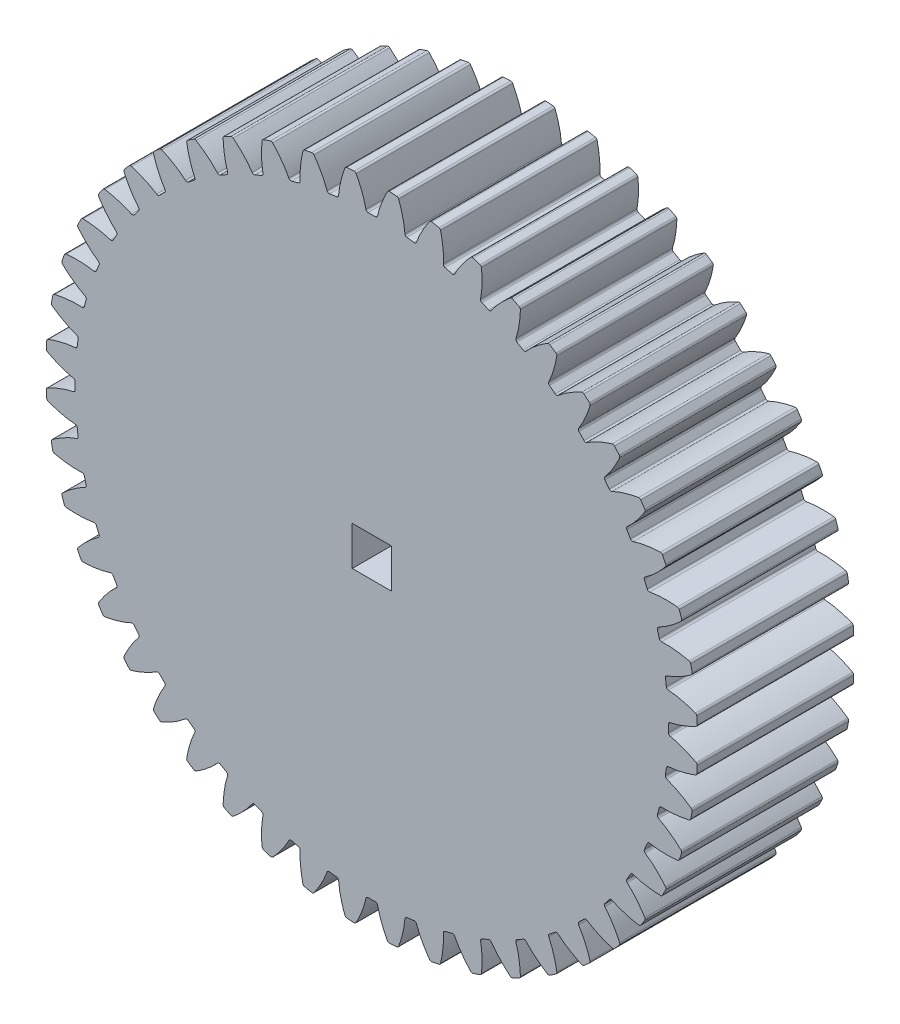
from build123d import *

# Parameters (mm, degrees)
SKETCH1_R                                = 26.458333333
BOSS_EXTRUDE1_DEPTH                      = 12.7
CUT_EXTRUDE_DCGTBC_DEPTH                 = 40.514260787
FILLET_TIP_DCGTBC_R                      = 0.177538081
CIRPATTERN_DCGTBC_COUNT                  = 48
FILLET_TIP_DCGTBC_OF_CIRPATTERN_DCGTBC_R = 0.177538081
SKETCH4_W                                = 3.175
SKETCH4_H                                = 3.175
CUT_EXTRUDE2_DEPTH                       = 40.462448771


with BuildPart() as part:
    # Sketch1 → Boss-Extrude1 (new body)
    with BuildSketch(Plane.XY):
        Circle(SKETCH1_R)
    extrude(amount=BOSS_EXTRUDE1_DEPTH)

    # DCGTBC → Cut-Extrude-DCGTBC (cut, through all)
    with BuildSketch(Plane.XY):
        with BuildLine():
            add(Edge.make_bspline(
                [(0.447553481, 24.072923331), (0.450058995, 24.089452909), (0.455904065, 24.126260881), (0.465792116, 24.183226136), (0.480724428, 24.260175986), (0.49787854, 24.340552683), (0.516428667, 24.420667039), (0.53620479, 24.500410735), (0.561693904, 24.596925766), (0.594390093, 24.712540909), (0.635715781, 24.84749397), (0.686255222, 25.000323012), (0.741691393, 25.155821333), (0.799468763, 25.308610829), (0.861560379, 25.462713766), (0.924269458, 25.611623931), (0.993215295, 25.766002124), (1.058792599, 25.908351423), (1.136483916, 26.067492253), (1.200413053, 26.195821105), (1.269974628, 26.328088554), (1.304350728, 26.392420017), (1.322138212, 26.42527868)],
                knots=[0.069847578, 0.069847578, 0.069847578, 0.069847578, 0.069847578, 0.092110526, 0.119476176, 0.146842496, 0.174208854, 0.201574956, 0.228941013, 0.256307345, 0.307035032, 0.361767352, 0.416499661, 0.471231937, 0.525964282, 0.580696616, 0.635428982, 0.690161387, 0.744893688, 0.799626082, 0.854358407, 0.909090914, 0.909090914, 0.909090914, 0.909090914, 0.909090914], degree=4))
            ThreePointArc((1.322138212, 26.42527868), (0, 26.458333333), (-1.322138212, 26.42527868))
            add(Edge.make_bspline(
                [(-0.447553481, 24.072923331), (-0.450058995, 24.089452909), (-0.455904065, 24.126260881), (-0.465792116, 24.183226136), (-0.480724428, 24.260175986), (-0.49787854, 24.340552683), (-0.516428667, 24.420667039), (-0.53620479, 24.500410735), (-0.561693904, 24.596925766), (-0.594390093, 24.712540909), (-0.635715781, 24.84749397), (-0.686255222, 25.000323012), (-0.741691393, 25.155821333), (-0.799468763, 25.308610829), (-0.861560379, 25.462713766), (-0.924269458, 25.611623931), (-0.993215295, 25.766002124), (-1.058792599, 25.908351423), (-1.136483916, 26.067492253), (-1.200413053, 26.195821105), (-1.269974628, 26.328088554), (-1.304350728, 26.392420017), (-1.322138212, 26.42527868)],
                knots=[0.069847578, 0.069847578, 0.069847578, 0.069847578, 0.069847578, 0.092110526, 0.119476176, 0.146842496, 0.174208854, 0.201574956, 0.228941013, 0.256307345, 0.307035032, 0.361767352, 0.416499661, 0.471231937, 0.525964282, 0.580696616, 0.635428982, 0.690161387, 0.744893688, 0.799626082, 0.854358407, 0.909090914, 0.909090914, 0.909090914, 0.909090914, 0.909090914], degree=4))
            ThreePointArc((-0.447553481, 24.072923331), (0, 24.077083333), (0.447553481, 24.072923331))
        make_face()
    cut_extrude_dcgtbc = extrude(amount=CUT_EXTRUDE_DCGTBC_DEPTH, mode=Mode.SUBTRACT)

    # Fillet-Tip-DCGTBC
    fillet_tip_dcgtbc_edges = [part.edges().sort_by_distance(p)[0] for p in [
        (1.322138212, 26.42527868, 6.35),
        (-1.322138212, 26.42527868, 6.35),
        (0.447553481, 24.072923331, 6.35),
        (-0.447553481, 24.072923331, 6.35),
    ]]
    fillet(fillet_tip_dcgtbc_edges, radius=FILLET_TIP_DCGTBC_R)

    # CirPattern-DCGTBC: Cut-Extrude-DCGTBC ×48 about axis
    cirpattern_dcgtbc_axis = Axis((0, 0, 12.7), (0, 0, 1))
    for i in range(1, CIRPATTERN_DCGTBC_COUNT):
        add(cut_extrude_dcgtbc.rotate(cirpattern_dcgtbc_axis, i * 360 / CIRPATTERN_DCGTBC_COUNT), mode=Mode.SUBTRACT)

    # Fillet-Tip-DCGTBC of CirPattern-DCGTBC
    fillet_tip_dcgtbc_of_cirpattern_dcgtbc_edges = [part.edges().sort_by_distance(p)[0] for p in [
        (-2.138363868, 26.371780424, 6.35),
        (-4.760018141, 26.026633091, 6.35),
        (-2.698422419, 23.925393587, 6.35),
        (-3.585871617, 23.808558684, 6.35),
        (-5.56227795, 25.867053694, 6.35),
        (-8.116452839, 25.182664595, 6.35),
        (-5.798227564, 23.368493725, 6.35),
        (-6.662834495, 23.136822996, 6.35),
        (-8.891019914, 24.919734502, 6.35),
        (-11.33401278, 23.907813725, 6.35),
        (-8.798823427, 22.411752456, 6.35),
        (-9.625794428, 22.069209851, 6.35),
        (-12.067634061, 23.546031745, 6.35),
        (-14.357644619, 22.223893533, 6.35),
        (-11.648868982, 21.071539889, 6.35),
        (-12.42405435, 20.623986408, 6.35),
        (-15.037767645, 21.769449856, 6.35),
        (-17.135613178, 20.159716362, 6.35),
        (-14.299599159, 19.370787432, 6.35),
        (-15.009735257, 18.825880839, 6.35),
        (-17.750600854, 19.620386645, 6.35),
        (-19.620386645, 17.750600854, 6.35),
        (-16.705659229, 17.338595432, 6.35),
        (-17.338595432, 16.705659229, 6.35),
        (-20.159716362, 17.135613178, 6.35),
        (-21.769449856, 15.037767645, 6.35),
        (-18.825880839, 15.009735257, 6.35),
        (-19.370787432, 14.299599159, 6.35),
        (-22.223893533, 14.357644619, 6.35),
        (-23.546031745, 12.067634061, 6.35),
        (-20.623986408, 12.42405435, 6.35),
        (-21.071539889, 11.648868982, 6.35),
        (-23.907813725, 11.33401278, 6.35),
        (-24.919734502, 8.891019914, 6.35),
        (-22.069209851, 9.625794428, 6.35),
        (-22.411752456, 8.798823427, 6.35),
        (-25.182664595, 8.116452839, 6.35),
        (-25.867053694, 5.56227795, 6.35),
        (-23.136822996, 6.662834495, 6.35),
        (-23.368493725, 5.798227564, 6.35),
        (-26.026633091, 4.760018141, 6.35),
        (-26.371780424, 2.138363868, 6.35),
        (-23.808558684, 3.585871617, 6.35),
        (-23.925393587, 2.698422419, 6.35),
        (-26.42527868, 1.322138212, 6.35),
        (-26.42527868, -1.322138212, 6.35),
        (-24.072923331, 0.447553481, 6.35),
        (-24.072923331, -0.447553481, 6.35),
        (-26.371780424, -2.138363868, 6.35),
        (-26.026633091, -4.760018141, 6.35),
        (-23.925393587, -2.698422419, 6.35),
        (-23.808558684, -3.585871617, 6.35),
        (-25.867053694, -5.56227795, 6.35),
        (-25.182664595, -8.116452839, 6.35),
        (-23.368493725, -5.798227564, 6.35),
        (-23.136822996, -6.662834495, 6.35),
        (-24.919734502, -8.891019914, 6.35),
        (-23.907813725, -11.33401278, 6.35),
        (-22.411752456, -8.798823427, 6.35),
        (-22.069209851, -9.625794428, 6.35),
        (-23.546031745, -12.067634061, 6.35),
        (-22.223893533, -14.357644619, 6.35),
        (-21.071539889, -11.648868982, 6.35),
        (-20.623986408, -12.42405435, 6.35),
        (-21.769449856, -15.037767645, 6.35),
        (-20.159716362, -17.135613178, 6.35),
        (-19.370787432, -14.299599159, 6.35),
        (-18.825880839, -15.009735257, 6.35),
        (-19.620386645, -17.750600854, 6.35),
        (-17.750600854, -19.620386645, 6.35),
        (-17.338595432, -16.705659229, 6.35),
        (-16.705659229, -17.338595432, 6.35),
        (-17.135613178, -20.159716362, 6.35),
        (-15.037767645, -21.769449856, 6.35),
        (-15.009735257, -18.825880839, 6.35),
        (-14.299599159, -19.370787432, 6.35),
        (-14.357644619, -22.223893533, 6.35),
        (-12.067634061, -23.546031745, 6.35),
        (-12.42405435, -20.623986408, 6.35),
        (-11.648868982, -21.071539889, 6.35),
        (-11.33401278, -23.907813725, 6.35),
        (-8.891019914, -24.919734502, 6.35),
        (-9.625794428, -22.069209851, 6.35),
        (-8.798823427, -22.411752456, 6.35),
        (-8.116452839, -25.182664595, 6.35),
        (-5.56227795, -25.867053694, 6.35),
        (-6.662834495, -23.136822996, 6.35),
        (-5.798227564, -23.368493725, 6.35),
        (-4.760018141, -26.026633091, 6.35),
        (-2.138363868, -26.371780424, 6.35),
        (-3.585871617, -23.808558684, 6.35),
        (-2.698422419, -23.925393587, 6.35),
        (-1.322138212, -26.42527868, 6.35),
        (1.322138212, -26.42527868, 6.35),
        (-0.447553481, -24.072923331, 6.35),
        (0.447553481, -24.072923331, 6.35),
        (2.138363868, -26.371780424, 6.35),
        (4.760018141, -26.026633091, 6.35),
        (2.698422419, -23.925393587, 6.35),
        (3.585871617, -23.808558684, 6.35),
        (5.56227795, -25.867053694, 6.35),
        (8.116452839, -25.182664595, 6.35),
        (5.798227564, -23.368493725, 6.35),
        (6.662834495, -23.136822996, 6.35),
        (8.891019914, -24.919734502, 6.35),
        (11.33401278, -23.907813725, 6.35),
        (8.798823427, -22.411752456, 6.35),
        (9.625794428, -22.069209851, 6.35),
        (12.067634061, -23.546031745, 6.35),
        (14.357644619, -22.223893533, 6.35),
        (11.648868982, -21.071539889, 6.35),
        (12.42405435, -20.623986408, 6.35),
        (15.037767645, -21.769449856, 6.35),
        (17.135613178, -20.159716362, 6.35),
        (14.299599159, -19.370787432, 6.35),
        (15.009735257, -18.825880839, 6.35),
        (17.750600854, -19.620386645, 6.35),
        (19.620386645, -17.750600854, 6.35),
        (16.705659229, -17.338595432, 6.35),
        (17.338595432, -16.705659229, 6.35),
        (20.159716362, -17.135613178, 6.35),
        (21.769449856, -15.037767645, 6.35),
        (18.825880839, -15.009735257, 6.35),
        (19.370787432, -14.299599159, 6.35),
        (22.223893533, -14.357644619, 6.35),
        (23.546031745, -12.067634061, 6.35),
        (20.623986408, -12.42405435, 6.35),
        (21.071539889, -11.648868982, 6.35),
        (23.907813725, -11.33401278, 6.35),
        (24.919734502, -8.891019914, 6.35),
        (22.069209851, -9.625794428, 6.35),
        (22.411752456, -8.798823427, 6.35),
        (25.182664595, -8.116452839, 6.35),
        (25.867053694, -5.56227795, 6.35),
        (23.136822996, -6.662834495, 6.35),
        (23.368493725, -5.798227564, 6.35),
        (26.026633091, -4.760018141, 6.35),
        (26.371780424, -2.138363868, 6.35),
        (23.808558684, -3.585871617, 6.35),
        (23.925393587, -2.698422419, 6.35),
        (26.42527868, -1.322138212, 6.35),
        (26.42527868, 1.322138212, 6.35),
        (24.072923331, -0.447553481, 6.35),
        (24.072923331, 0.447553481, 6.35),
        (26.371780424, 2.138363868, 6.35),
        (26.026633091, 4.760018141, 6.35),
        (23.925393587, 2.698422419, 6.35),
        (23.808558684, 3.585871617, 6.35),
        (25.867053694, 5.56227795, 6.35),
        (25.182664595, 8.116452839, 6.35),
        (23.368493725, 5.798227564, 6.35),
        (23.136822996, 6.662834495, 6.35),
        (24.919734502, 8.891019914, 6.35),
        (23.907813725, 11.33401278, 6.35),
        (22.411752456, 8.798823427, 6.35),
        (22.069209851, 9.625794428, 6.35),
        (23.546031745, 12.067634061, 6.35),
        (22.223893533, 14.357644619, 6.35),
        (21.071539889, 11.648868982, 6.35),
        (20.623986408, 12.42405435, 6.35),
        (21.769449856, 15.037767645, 6.35),
        (20.159716362, 17.135613178, 6.35),
        (19.370787432, 14.299599159, 6.35),
        (18.825880839, 15.009735257, 6.35),
        (19.620386645, 17.750600854, 6.35),
        (17.750600854, 19.620386645, 6.35),
        (17.338595432, 16.705659229, 6.35),
        (16.705659229, 17.338595432, 6.35),
        (17.135613178, 20.159716362, 6.35),
        (15.037767645, 21.769449856, 6.35),
        (15.009735257, 18.825880839, 6.35),
        (14.299599159, 19.370787432, 6.35),
        (14.357644619, 22.223893533, 6.35),
        (12.067634061, 23.546031745, 6.35),
        (12.42405435, 20.623986408, 6.35),
        (11.648868982, 21.071539889, 6.35),
        (11.33401278, 23.907813725, 6.35),
        (8.891019914, 24.919734502, 6.35),
        (9.625794428, 22.069209851, 6.35),
        (8.798823427, 22.411752456, 6.35),
        (8.116452839, 25.182664595, 6.35),
        (5.56227795, 25.867053694, 6.35),
        (6.662834495, 23.136822996, 6.35),
        (5.798227564, 23.368493725, 6.35),
        (4.760018141, 26.026633091, 6.35),
        (2.138363868, 26.371780424, 6.35),
        (3.585871617, 23.808558684, 6.35),
        (2.698422419, 23.925393587, 6.35),
    ]]
    fillet(fillet_tip_dcgtbc_of_cirpattern_dcgtbc_edges, radius=FILLET_TIP_DCGTBC_OF_CIRPATTERN_DCGTBC_R)

    # Sketch4 → Cut-Extrude2 (cut, through all)
    with BuildSketch(Plane.XY.offset(12.7)):
        Rectangle(SKETCH4_W, SKETCH4_H)
    extrude(amount=-CUT_EXTRUDE2_DEPTH, mode=Mode.SUBTRACT)


solid = part.part
